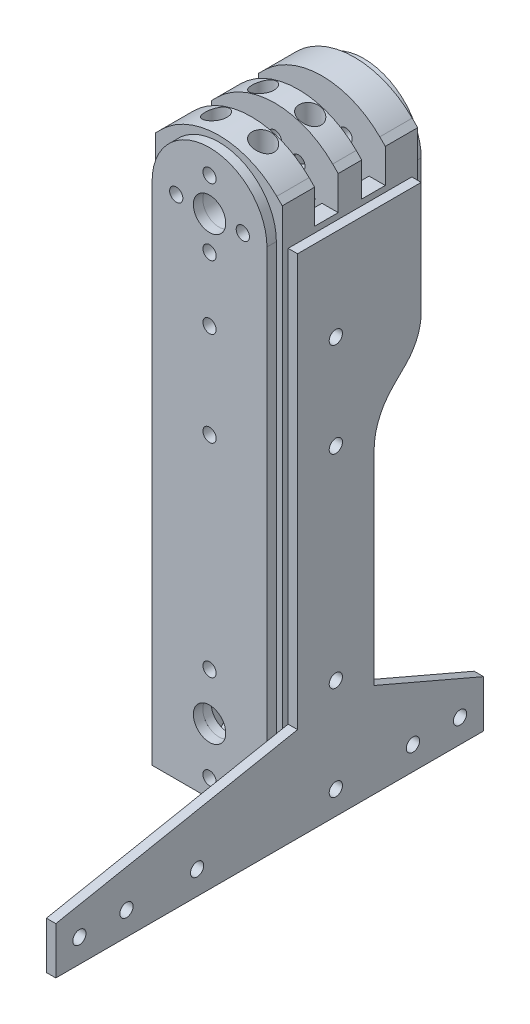
from build123d import *
from OCP.BRepAlgoAPI import BRepAlgoAPI_Cut
from OCP.TopTools import TopTools_ListOfShape

# Parameters (mm, degrees)
BOSS_EXTRUDE6_DEPTH             = 21.5
CHAMFER1_SIZE                   = 10
FILLET2_R                       = 27.763456
FILLET3_R                       = 20
CUT_EXTRUDE6_DEPTH              = 4
CUT_EXTRUDE7_DEPTH              = 179.042831925
CUT_EXTRUDE7_DEPTH_BACK         = 179.042831925
SKETCH13_R                      = 5.5
CUT_EXTRUDE8_START              = -20
CUT_EXTRUDE8_OUTLINE_R          = 5.5
CUT_EXTRUDE8_DEPTH              = 8
SKETCH14_R                      = 2.25
CUT_EXTRUDE9_DEPTH              = 179.042831925
CIRPATTERN1_COUNT               = 4
CUT_EXTRUDE10_REACH             = 180.043
SKETCH15_R                      = 2.25
CUT_EXTRUDE10_DIRECTION_2_DEPTH = 179.042831925
CIRPATTERN2_COUNT               = 4
CUT_EXTRUDE11_START             = -174
CUT_EXTRUDE11_DEPTH             = 144
CUT_EXTRUDE12_DEPTH             = 179.042831925
CUT_EXTRUDE12_DEPTH_BACK        = 179.042831925
SKETCH20_R                      = 2.25
CUT_EXTRUDE15_DEPTH             = 179.042831925
CUT_EXTRUDE15_DEPTH_BACK        = 24
SKETCH21_R                      = 3.75
SKETCH22_R                      = 2.25
SKETCH22_R_2                    = 5.5
BOSS_EXTRUDE7_DEPTH             = 3.2
SKETCH23_R                      = 2.25
SKETCH23_R_2                    = 5.5
BOSS_EXTRUDE8_DEPTH             = 3.2
SKETCH26_W                      = 39
SKETCH26_H                      = 97.215728753
BOSS_EXTRUDE10_DEPTH            = 3.2
SKETCH25_R                      = 2.25
BOSS_EXTRUDE9_DEPTH             = 3.2
SKETCH28_R                      = 5.5
CUT_EXTRUDE17_DEPTH             = 200.834692684
SKETCH31_R                      = 2.25
CUT_EXTRUDE21_DEPTH             = 200.834692684
CIRPATTERN8_COUNT               = 4
SKETCH32_R                      = 2.25
CUT_EXTRUDE22_DEPTH             = 200.834692684
CIRPATTERN9_COUNT               = 4
SKETCH33_R                      = 2.25
CUT_EXTRUDE23_DEPTH             = 200.834692684
CIRPATTERN10_COUNT              = 4
CUT_EXTRUDE24_START             = -6.1
SKETCH34_R                      = 2.25
CUT_EXTRUDE24_DEPTH             = 6.1


with BuildPart() as part:
    # Sketch11 → Boss-Extrude6 (new, symmetric)
    with BuildSketch(Plane(origin=(0, 0, 0), x_dir=(0, 0, -1), z_dir=(1, 0, 0))):
        Polygon((-15, 21.5), (-15, -174), (15, -174), (15, -64.5), (31, -48.5), (31, 21.5), align=None)
    extrude(amount=BOSS_EXTRUDE6_DEPTH, both=True)

    # Chamfer1
    chamfer1_edges = [part.edges().sort_by_distance(p)[0] for p in [
        (21.5, 21.5, -8),
        (-21.5, 21.5, -8),
    ]]
    chamfer(chamfer1_edges, length=CHAMFER1_SIZE)

    # Fillet2
    fillet2_edges = [part.edges().sort_by_distance(p)[0] for p in [
        (11.5, 21.5, -8),
        (-11.5, 21.5, -8),
    ]]
    fillet(fillet2_edges, radius=FILLET2_R - 0.0001)  # a hair under: the kernel refuses the full size

    # Fillet3
    fillet3_edges = [part.edges().sort_by_distance(p)[0] for p in [
        (0, -48.5, -31),
        (0, -64.5, -15),
    ]]
    fillet(fillet3_edges, radius=FILLET3_R)


with BuildPart() as cut_extrude6_tool:
    # Sketch12 → Cut-Extrude6 (new, symmetric)
    with BuildSketch(Plane.XY):
        with BuildLine():
            Line((-21.5, 0), (-16, 0))
            ThreePointArc((-16, 0), (0, -16), (16, 0))
            Line((16, 0), (21.5, 0))
            Line((21.5, 0), (21.5, 11.5))
            Line((21.5, 11.5), (19.631727984, 13.368272016))
            ThreePointArc((19.631727984, 13.368272016), (0, 21.5), (-19.631727984, 13.368272016))
            Line((-19.631727984, 13.368272016), (-21.5, 11.5))
            Line((-21.5, 11.5), (-21.5, 0))
        make_face()
    extrude(amount=CUT_EXTRUDE6_DEPTH, both=True)


with BuildPart() as part_1:
    add(part.part)

    # Cut-Extrude6: cut by cut_extrude6_tool, with a tolerance
    cut_extrude6_stock = TopTools_ListOfShape()
    cut_extrude6_stock.Append(part_1.part.wrapped)
    cut_extrude6_tools = TopTools_ListOfShape()
    cut_extrude6_tools.Append(cut_extrude6_tool.part.wrapped)
    cut_extrude6_cut = BRepAlgoAPI_Cut()
    cut_extrude6_cut.SetArguments(cut_extrude6_stock)
    cut_extrude6_cut.SetTools(cut_extrude6_tools)
    cut_extrude6_cut.SetFuzzyValue(0.00001)
    cut_extrude6_cut.Build()
    add(Compound.cast(cut_extrude6_cut.Shape()).solids(), mode=Mode.REPLACE)

    # Sketch13 → Cut-Extrude7 (cut, two sides: drawn at the far end of the back side and taken through both)
    with BuildSketch(Plane.XY.offset(-CUT_EXTRUDE7_DEPTH_BACK)):
        Circle(SKETCH13_R)
    extrude(amount=CUT_EXTRUDE7_DEPTH + CUT_EXTRUDE7_DEPTH_BACK, mode=Mode.SUBTRACT)


with BuildPart() as cut_extrude8_tool:
    # Cut-Extrude8: read off the stored shape, not the designer's step
    # Cut-Extrude8 outline → Cut-Extrude8 (new body)
    with BuildSketch(Plane.XY.offset(CUT_EXTRUDE8_START)):
        with BuildLine():
            ThreePointArc((-16, 0), (0, -16), (16, 0))
            Line((16, 0), (21.5, 0))
            Line((21.5, 0), (21.5, 11.5))
            Line((21.5, 11.5), (19.631727984, 13.368272016))
            ThreePointArc((19.631727984, 13.368272016), (0, 21.5), (-19.631727984, 13.368272016))
            Line((-19.631727984, 13.368272016), (-21.5, 11.5))
            Line((-21.5, 11.5), (-21.5, 0))
            Line((-21.5, 0), (-16, 0))
        make_face()
        Circle(CUT_EXTRUDE8_OUTLINE_R, mode=Mode.SUBTRACT)
    extrude(amount=CUT_EXTRUDE8_DEPTH)


with BuildPart() as part_2:
    add(part_1.part)

    # Cut-Extrude8: cut by cut_extrude8_tool, with a tolerance
    cut_extrude8_stock = TopTools_ListOfShape()
    cut_extrude8_stock.Append(part_2.part.wrapped)
    cut_extrude8_tools = TopTools_ListOfShape()
    cut_extrude8_tools.Append(cut_extrude8_tool.part.wrapped)
    cut_extrude8_cut = BRepAlgoAPI_Cut()
    cut_extrude8_cut.SetArguments(cut_extrude8_stock)
    cut_extrude8_cut.SetTools(cut_extrude8_tools)
    cut_extrude8_cut.SetFuzzyValue(0.00001)
    cut_extrude8_cut.Build()
    add(Compound.cast(cut_extrude8_cut.Shape()).solids(), mode=Mode.REPLACE)

    # Sketch14 → Cut-Extrude9 (cut, through all)
    with BuildSketch(Plane.XY):
        with Locations((-8, 8)):
            Circle(SKETCH14_R)
    cut_extrude9 = extrude(amount=-CUT_EXTRUDE9_DEPTH, mode=Mode.SUBTRACT)

    # CirPattern1: Cut-Extrude9 ×4 about axis
    cirpattern1_axis = Axis((0, 0, 0), (0, 0, 1))
    for i in range(1, CIRPATTERN1_COUNT):
        add(cut_extrude9.rotate(cirpattern1_axis, i * 360 / CIRPATTERN1_COUNT), mode=Mode.SUBTRACT)

    # Cut-Extrude10: up to this face of the body (flat: up to its plane)
    cut_extrude10_end = Plane(part_2.part.faces().sort_by_distance((0, -15.429452018, -12))[0])
    # Sketch15 → Cut-Extrude10 (cut, up to the picked face)
    with BuildSketch(Plane.XY, mode=Mode.PRIVATE) as cut_extrude10_sk1:
        with Locations((0, 11.313708499)):
            Circle(SKETCH15_R)
    cut_extrude10_tool1 = split(extrude(cut_extrude10_sk1.sketch, amount=-CUT_EXTRUDE10_REACH, mode=Mode.PRIVATE), bisect_by=cut_extrude10_end, keep=Keep.BOTH, mode=Mode.PRIVATE)
    cut_extrude10 = cut_extrude10_tool1.solids().sort_by(Axis((0, 11.313708, 0), (0, 0, -1)))[0]
    add(cut_extrude10, mode=Mode.SUBTRACT)

    # Sketch15 → Cut-Extrude10 direction 2 (cut)
    with BuildSketch(Plane.XY):
        with Locations((0, 11.313708499)):
            Circle(SKETCH15_R)
    cut_extrude10_direction_2 = extrude(amount=CUT_EXTRUDE10_DIRECTION_2_DEPTH, mode=Mode.SUBTRACT)

    # CirPattern2: Cut-Extrude10, Cut-Extrude10 direction 2 ×4 about axis
    cirpattern2_axis = Axis((0, 0, 0), (0, 0, 1))
    add([cut_extrude10.rotate(cirpattern2_axis, i * 360 / CIRPATTERN2_COUNT) for i in range(1, CIRPATTERN2_COUNT)], mode=Mode.SUBTRACT)
    add([cut_extrude10_direction_2.rotate(cirpattern2_axis, i * 360 / CIRPATTERN2_COUNT) for i in range(1, CIRPATTERN2_COUNT)], mode=Mode.SUBTRACT)

    # Sketch16 → Cut-Extrude11 (cut)
    with BuildSketch(Plane(origin=(0, 0, 0), x_dir=(1, 0, 0), z_dir=(0, 1, 0)).offset(CUT_EXTRUDE11_START)):
        with BuildLine():
            Line((-10.620734438, 12.1), (10.620734438, 12.1))
            ThreePointArc((10.620734438, 12.1), (11.384419177, 11.384419177), (12.1, 10.620734438))
            Line((12.1, 10.620734438), (12.1, -10.620734438))
            ThreePointArc((12.1, -10.620734438), (11.384419177, -11.384419177), (10.620734438, -12.1))
            Line((10.620734438, -12.1), (-10.620734438, -12.1))
            ThreePointArc((-10.620734438, -12.1), (-11.384419177, -11.384419177), (-12.1, -10.620734438))
            Line((-12.1, -10.620734438), (-12.1, 10.620734438))
            ThreePointArc((-12.1, 10.620734438), (-11.384419177, 11.384419177), (-10.620734438, 12.1))
        make_face()
    extrude(amount=CUT_EXTRUDE11_DEPTH, mode=Mode.SUBTRACT)

    # Sketch20 → Cut-Extrude12 (cut, two sides: drawn at the far end of the back side and taken through both)
    with BuildSketch(Plane(origin=(0, 0, 0), x_dir=(1, 0, 0), z_dir=(0, 1, 0)).offset(-CUT_EXTRUDE12_DEPTH_BACK)):
        with Locations(Location((-8, 8, 0), (0, 0, 270))):
            Circle(SKETCH20_R)
        with Locations(Location((8, 8, 0), (0, 0, 270))):
            Circle(SKETCH20_R)
        with Locations(Location((8, -8, 0), (0, 0, 270))):
            Circle(SKETCH20_R)
        with Locations(Location((-8, -8, 0), (0, 0, 270))):
            Circle(SKETCH20_R)
    extrude(amount=CUT_EXTRUDE12_DEPTH + CUT_EXTRUDE12_DEPTH_BACK, mode=Mode.SUBTRACT)

    # Sketch21 → Cut-Extrude15 (cut, two sides: drawn at the far end of the back side and taken through both)
    with BuildSketch(Plane(origin=(0, 0, 0), x_dir=(1, 0, 0), z_dir=(0, 1, 0)).offset(-CUT_EXTRUDE15_DEPTH_BACK)):
        with Locations(Location((-8, 8, 0), (0, 0, 90))):
            Circle(SKETCH21_R)
        with Locations(Location((8, 8, 0), (0, 0, 90))):
            Circle(SKETCH21_R)
        with Locations(Location((8, -8, 0), (0, 0, 90))):
            Circle(SKETCH21_R)
        with Locations(Location((-8, -8, 0), (0, 0, 90))):
            Circle(SKETCH21_R)
    extrude(amount=CUT_EXTRUDE15_DEPTH + CUT_EXTRUDE15_DEPTH_BACK, mode=Mode.SUBTRACT)


with BuildPart() as body_2:
    # Sketch22 → Boss-Extrude7 (new body)
    with BuildSketch(Plane.XY.offset(15)):
        with BuildLine():
            Line((-19.5, 0), (-19.5, -172))
            Line((-19.5, -172), (19.5, -172))
            Line((19.5, -172), (19.5, 0))
            ThreePointArc((19.5, 0), (0, 19.5), (-19.5, 0))
        make_face()
        with Locations((0, 11.313708499)):
            Circle(SKETCH22_R, mode=Mode.SUBTRACT)
        with Locations((0, -11.313708499)):
            Circle(SKETCH22_R, mode=Mode.SUBTRACT)
        with Locations((11.313708499, 0)):
            Circle(SKETCH22_R, mode=Mode.SUBTRACT)
        Circle(SKETCH22_R_2, mode=Mode.SUBTRACT)
        with Locations((-11.313708499, 0)):
            Circle(SKETCH22_R, mode=Mode.SUBTRACT)
    extrude(amount=BOSS_EXTRUDE7_DEPTH)


with BuildPart() as body_3:
    # Sketch23 → Boss-Extrude8 (new body)
    with BuildSketch(Plane(origin=(0, 0, -31), x_dir=(-1, 0, 0), z_dir=(0, 0, -1))):
        with BuildLine():
            Line((-19.5, 0), (-19.5, -38.215728753))
            Line((-19.5, -38.215728753), (19.5, -38.215728753))
            Line((19.5, -38.215728753), (19.5, 0))
            ThreePointArc((19.5, 0), (0, 19.5), (-19.5, 0))
        make_face()
        with Locations((8, 8)):
            Circle(SKETCH23_R, mode=Mode.SUBTRACT)
        with Locations((8, -8)):
            Circle(SKETCH23_R, mode=Mode.SUBTRACT)
        with Locations((-8, -8)):
            Circle(SKETCH23_R, mode=Mode.SUBTRACT)
        Circle(SKETCH23_R_2, mode=Mode.SUBTRACT)
        with Locations((-8, 8)):
            Circle(SKETCH23_R, mode=Mode.SUBTRACT)
    extrude(amount=BOSS_EXTRUDE8_DEPTH)


with BuildPart() as body_4:
    # Sketch26 → Boss-Extrude10 (new body)
    with BuildSketch(Plane(origin=(0, 0, -15), x_dir=(-1, 0, 0), z_dir=(0, 0, -1))):
        with Locations((0, -123.392135623)):
            Rectangle(SKETCH26_W, SKETCH26_H)
    extrude(amount=BOSS_EXTRUDE10_DEPTH)


with BuildPart() as body_5:
    # Sketch25 → Boss-Extrude9 (new body)
    with BuildSketch(Plane(origin=(21.5, 0, 0), x_dir=(0, 0, -1), z_dir=(1, 0, 0))):
        with BuildLine():
            Line((13, -72.784271247), (13, -142))
            Line((13, -142), (50.2, -158))
            Line((50.2, -158), (50.2, -174))
            Line((50.2, -174), (-95.12, -174))
            Line((-95.12, -174), (-95.12, -158))
            Line((-95.12, -158), (-13, -142))
            Line((-13, -142), (-13, -2))
            Line((-13, -2), (29, -2))
            Line((29, -2), (29, -40.215728753))
            ThreePointArc((29, -40.215728753), (27.629831585, -47.104030535), (23.727922061, -52.943650814))
            Line((23.727922061, -52.943650814), (19.443650814, -57.227922061))
            ThreePointArc((19.443650814, -57.227922061), (14.674650285, -64.365235735), (13, -72.784271247))
        make_face()
        with Locations((-47.12, -166)):
            Circle(SKETCH25_R, mode=Mode.SUBTRACT)
        with Locations((-71.12, -166)):
            Circle(SKETCH25_R, mode=Mode.SUBTRACT)
        with Locations((-87.12, -166)):
            Circle(SKETCH25_R, mode=Mode.SUBTRACT)
        with Locations((26.2, -166)):
            Circle(SKETCH25_R, mode=Mode.SUBTRACT)
        with Locations((42.2, -166)):
            Circle(SKETCH25_R, mode=Mode.SUBTRACT)
    extrude(amount=BOSS_EXTRUDE9_DEPTH)


with BuildPart() as cut_extrude17_tool:
    # Sketch28 → Cut-Extrude17 (new, through all)
    with BuildSketch(Plane.XY):
        with Locations((0, -150)):
            Circle(SKETCH28_R)
    extrude(amount=CUT_EXTRUDE17_DEPTH)


with BuildPart() as part_3:
    add(part_2.part)

    # Cut-Extrude17: cut by cut_extrude17_tool
    add(cut_extrude17_tool.part, mode=Mode.SUBTRACT)


with BuildPart() as body_2_1:
    add(body_2.part)

    # Cut-Extrude17: cut by cut_extrude17_tool
    add(cut_extrude17_tool.part, mode=Mode.SUBTRACT)


with BuildPart() as cut_extrude21_tool:
    # Sketch31 → Cut-Extrude21 (new, through all)
    with BuildSketch(Plane.XY):
        with Locations((0, -33)):
            Circle(SKETCH31_R)
    cut_extrude21 = extrude(amount=-CUT_EXTRUDE21_DEPTH)


with BuildPart() as part_4:
    add(part_3.part)

    # Cut-Extrude21: cut by cut_extrude21_tool
    add(cut_extrude21_tool.part, mode=Mode.SUBTRACT)


with BuildPart() as body_3_1:
    add(body_3.part)

    # Cut-Extrude21: cut by cut_extrude21_tool
    add(cut_extrude21_tool.part, mode=Mode.SUBTRACT)


with BuildPart() as cirpattern8_tool:
    # CirPattern8: Cut-Extrude21 ×4 about axis
    cirpattern8_axis = Axis((0, -30, 0), (0, -1, 0))
    for i in range(1, CIRPATTERN8_COUNT):
        add(cut_extrude21.rotate(cirpattern8_axis, i * 360 / CIRPATTERN8_COUNT))


with BuildPart() as part_5:
    add(part_4.part)

    # CirPattern8: cut by cirpattern8_tool
    add(cirpattern8_tool.part, mode=Mode.SUBTRACT)


with BuildPart() as body_2_2:
    add(body_2_1.part)

    # CirPattern8: cut by cirpattern8_tool
    add(cirpattern8_tool.part, mode=Mode.SUBTRACT)


with BuildPart() as body_5_1:
    add(body_5.part)

    # CirPattern8: cut by cirpattern8_tool
    add(cirpattern8_tool.part, mode=Mode.SUBTRACT)


with BuildPart() as cut_extrude22_tool:
    # Sketch32 → Cut-Extrude22 (new, through all)
    with BuildSketch(Plane(origin=(0, 0, 0), x_dir=(0, 0, -1), z_dir=(1, 0, 0))):
        with Locations((0, -65)):
            Circle(SKETCH32_R)
    cut_extrude22 = extrude(amount=CUT_EXTRUDE22_DEPTH)


with BuildPart() as part_6:
    add(part_5.part)

    # Cut-Extrude22: cut by cut_extrude22_tool
    add(cut_extrude22_tool.part, mode=Mode.SUBTRACT)


with BuildPart() as body_5_2:
    add(body_5_1.part)

    # Cut-Extrude22: cut by cut_extrude22_tool
    add(cut_extrude22_tool.part, mode=Mode.SUBTRACT)


with BuildPart() as cirpattern9_tool:
    # CirPattern9: Cut-Extrude22 ×4 about axis, 1 skipped
    cirpattern9_axis = Axis((0, -33, 0), (0, -1, 0))
    add([cut_extrude22.rotate(cirpattern9_axis, i * 360 / CIRPATTERN9_COUNT) for i in range(1, CIRPATTERN9_COUNT) if i not in (3,)])


with BuildPart() as part_7:
    add(part_6.part)

    # CirPattern9: cut by cirpattern9_tool
    add(cirpattern9_tool.part, mode=Mode.SUBTRACT)


with BuildPart() as body_2_3:
    add(body_2_2.part)

    # CirPattern9: cut by cirpattern9_tool
    add(cirpattern9_tool.part, mode=Mode.SUBTRACT)


with BuildPart() as cut_extrude23_tool:
    # Sketch33 → Cut-Extrude23 (new, through all)
    with BuildSketch(Plane(origin=(0, 0, 0), x_dir=(0, 0, -1), z_dir=(1, 0, 0))):
        with Locations((0, -134)):
            Circle(SKETCH33_R)
        with Locations((0, -166)):
            Circle(SKETCH33_R)
    cut_extrude23 = extrude(amount=CUT_EXTRUDE23_DEPTH)


with BuildPart() as part_8:
    add(part_7.part)

    # Cut-Extrude23: cut by cut_extrude23_tool
    add(cut_extrude23_tool.part, mode=Mode.SUBTRACT)


with BuildPart() as body_5_3:
    add(body_5_2.part)

    # Cut-Extrude23: cut by cut_extrude23_tool
    add(cut_extrude23_tool.part, mode=Mode.SUBTRACT)


with BuildPart() as cirpattern10_tool:
    # CirPattern10: Cut-Extrude23 ×4 about axis, 1 skipped
    cirpattern10_axis = Axis((0, -134, 0), (0, 1, 0))
    add([cut_extrude23.rotate(cirpattern10_axis, i * 360 / CIRPATTERN10_COUNT) for i in range(1, CIRPATTERN10_COUNT) if i not in (1,)])


with BuildPart() as part_9:
    add(part_8.part)

    # CirPattern10: cut by cirpattern10_tool
    add(cirpattern10_tool.part, mode=Mode.SUBTRACT)


with BuildPart() as body_2_4:
    add(body_2_3.part)

    # CirPattern10: cut by cirpattern10_tool
    add(cirpattern10_tool.part, mode=Mode.SUBTRACT)


with BuildPart() as cut_extrude24_tool:
    # Sketch34 → Cut-Extrude24 (new body)
    with BuildSketch(Plane(origin=(0, 0, -18.2), x_dir=(-1, 0, 0), z_dir=(0, 0, -1)).offset(CUT_EXTRUDE24_START)):
        with Locations(Location((0, -107.392135624, 0), (0, 0, 90))):
            Circle(SKETCH34_R)
        with Locations(Location((0, -139.392135624, 0), (0, 0, 90))):
            Circle(SKETCH34_R)
    extrude(amount=CUT_EXTRUDE24_DEPTH)


with BuildPart() as part_10:
    add(part_9.part)

    # Cut-Extrude24: cut by cut_extrude24_tool
    add(cut_extrude24_tool.part, mode=Mode.SUBTRACT)


with BuildPart() as body_4_1:
    add(body_4.part)

    # Cut-Extrude24: cut by cut_extrude24_tool
    add(cut_extrude24_tool.part, mode=Mode.SUBTRACT)


solid = Compound([body_3_1.part, body_5_3.part, body_2_4.part, part_10.part, body_4_1.part])
